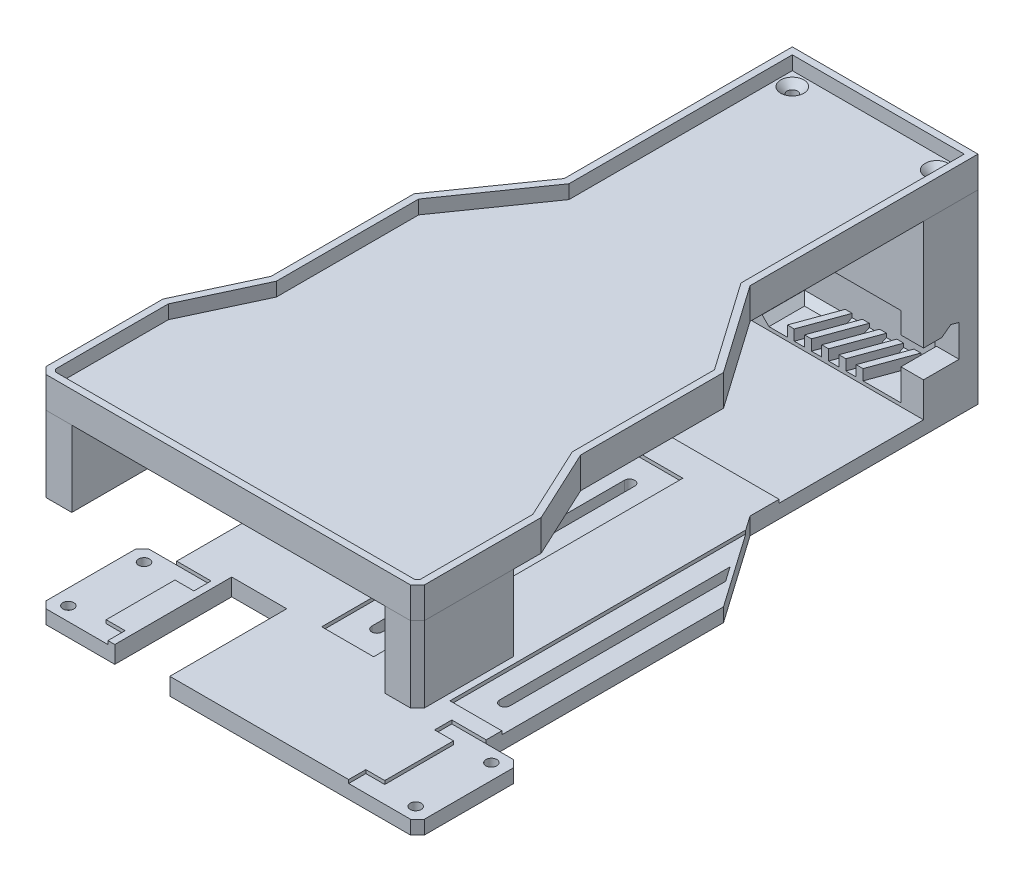
from build123d import *

# Parameters (mm, degrees)
SKETCH1_W                    = 90
SKETCH1_H                    = 190
BOSS_EXTRUDE1_DEPTH          = 5
SKETCH2_W                    = 10
SKETCH2_H                    = 30
BOSS_EXTRUDE2_DEPTH          = 5
CHAMFER1_SIZE                = 2
SKETCH3_W                    = 16
SKETCH3_H                    = 34
CUT_EXTRUDE1_DEPTH           = 50
SKETCH4_W                    = 90
SKETCH4_H                    = 42
CUT_EXTRUDE2_DEPTH           = 1
SKETCH7_W                    = 15.1
SKETCH7_H                    = 89.916335477
CUT_EXTRUDE7_DEPTH           = 1
BOSS_EXTRUDE4_START          = 5
BOSS_EXTRUDE4_DEPTH          = 13
BOSS_EXTRUDE5_DEPTH          = 3.1
CUT_EXTRUDE11_START          = 5
CUT_EXTRUDE11_DEPTH          = 1
CUT_EXTRUDE12_DEPTH          = 112.23848255
CUT_EXTRUDE12_DEPTH_BACK     = 112.23848255
BOSS_EXTRUDE6_DEPTH          = 1
CHAMFER4_SIZE                = 2
CUT_EXTRUDE13_REACH          = 114.094
SKETCH23_R                   = 1.5
CUT_EXTRUDE14_DEPTH          = 113.093556715
CUT_EXTRUDE14_DEPTH_BACK     = 113.093556715
SKETCH27_W                   = 2.002698481
SKETCH27_H                   = 10.340179912
BOSS_EXTRUDE7_DEPTH          = 8
BOSS_EXTRUDE10_DEPTH         = 8
BOSS_EXTRUDE11_OUTLINE_W     = 4.559976017
BOSS_EXTRUDE11_OUTLINE_H     = 15.84
BOSS_EXTRUDE11_DEPTH         = 13
BOSS_EXTRUDE12_DEPTH         = 12
SKETCH34_W                   = 46.940023983
SKETCH34_H                   = 1.75
BOSS_EXTRUDE13_DEPTH         = 12.34
SKETCH35_W                   = 6.562674498
SKETCH35_H                   = 5.170089956
BOSS_EXTRUDE14_DEPTH         = 15.25
SKETCH36_W                   = 6.562674498
SKETCH36_H                   = 8
CUT_EXTRUDE15_DEPTH          = 5.170089956
CHAMFER5_SIZE                = 8.360382376
CHAMFER5_SIZE_2              = 6.3
CHAMFER6_SIZE                = 3
CHAMFER6_SIZE2               = 2.492460212
SKETCH37_W                   = 6.562674498
SKETCH37_H                   = 5.170089956
BOSS_EXTRUDE15_DEPTH         = 1.075733433
BOSS_EXTRUDE16_START         = 24
BOSS_EXTRUDE16_DEPTH         = 5
BOSS_EXTRUDE17_DEPTH         = 4
SKETCH40_W                   = 54
SKETCH40_H                   = 15.84
BOSS_EXTRUDE18_DEPTH         = 24
BOSS_EXTRUDE19_START         = 32
BOSS_EXTRUDE19_DEPTH         = 22
SPLIT1_START                 = 54
SPLIT1_DEPTH                 = 5
SPLIT1_START_2               = 32
SPLIT1_2_DEPTH               = 22
SPLIT1_START_3               = 59
SPLIT1_3_DEPTH               = 4
SPLIT1_4_DEPTH               = 9
SPLIT1_5_DEPTH               = 22
BOSS_EXTRUDE20_DEPTH         = 4
CSK_FOR_M3_SFHCS1_AT_2_COUNT = 2
CSK_FOR_M3_SFHCS1_AT_2_PITCH = 22
CSK_FOR_M3_SFHCS1_AT_3_COUNT = 2
CSK_FOR_M3_SFHCS1_AT_3_PITCH = 103.368273663
CSK_FOR_M3_SFHCS1_AT_4_COUNT = 2
CSK_FOR_M3_SFHCS1_AT_4_PITCH = 101
CSK_FOR_M3_SFHCS2_AT_2_COUNT = 2
CSK_FOR_M3_SFHCS2_AT_2_PITCH = 42
SPLIT2_START                 = 32
SPLIT2_DEPTH                 = 22
SPLIT2_2_DEPTH               = 22
SPLIT2_3_DEPTH               = 22


# Read off the part's stored shape, not the designer's step: Boss-Extrude11, Split1, Split2
with BuildPart() as part:
    # Sketch1 → Boss-Extrude1 (new body)
    with BuildSketch(Plane(origin=(0, 0, 0), x_dir=(1, 0, 0), z_dir=(0, 1, 0))):
        Rectangle(SKETCH1_W, SKETCH1_H)
    extrude(amount=BOSS_EXTRUDE1_DEPTH)

    # Sketch2 → Boss-Extrude2 (add)
    with BuildSketch(Plane(origin=(0, 0, 0), x_dir=(1, 0, 0), z_dir=(0, 1, 0))):
        with Locations((-50, -80)):
            Rectangle(SKETCH2_W, SKETCH2_H)
        with Locations((50, -80)):
            Rectangle(SKETCH2_W, SKETCH2_H)
    extrude(amount=BOSS_EXTRUDE2_DEPTH)

    # Chamfer1
    chamfer1_edges = [part.edges().sort_by_distance(p)[0] for p in [
        (-55, 2.5, 65),
        (-55, 2.5, 95),
        (55, 2.5, 95),
        (55, 2.5, 65),
    ]]
    chamfer(chamfer1_edges, length=CHAMFER1_SIZE)

    # Sketch3 → Cut-Extrude1 (cut)
    with BuildSketch(Plane(origin=(0, 5, 0), x_dir=(1, 0, 0), z_dir=(0, 1, 0))):
        with Locations((-25, -78)):
            Rectangle(SKETCH3_W, SKETCH3_H)
    extrude(amount=-CUT_EXTRUDE1_DEPTH, mode=Mode.SUBTRACT)

    # Sketch4 → Cut-Extrude2 (cut)
    with BuildSketch(Plane(origin=(0, 5, 0), x_dir=(1, 0, 0), z_dir=(0, 1, 0))):
        with Locations((0, 59.159820088)):
            Rectangle(SKETCH4_W, SKETCH4_H)
    extrude(amount=-CUT_EXTRUDE2_DEPTH, mode=Mode.SUBTRACT)

    # Sketch7 → Cut-Extrude7 (cut)
    with BuildSketch(Plane(origin=(0, 5, 0), x_dir=(1, 0, 0), z_dir=(0, 1, 0))):
        with Locations((37.45, -15.495273531)):
            Rectangle(SKETCH7_W, SKETCH7_H)
        with Locations((0.16773297, -15.495273531)):
            Rectangle(SKETCH7_W, SKETCH7_H)
    extrude(amount=-CUT_EXTRUDE7_DEPTH, mode=Mode.SUBTRACT)

    # Sketch17 → Boss-Extrude4 (add)
    with BuildSketch(Plane(origin=(0, 0, 0), x_dir=(1, 0, 0), z_dir=(0, 1, 0)).offset(BOSS_EXTRUDE4_START)):
        Polygon((-22.440023983, 80.159820088), (-19.940023983, 80.159820088), (-19.940023983, 92.499820088), (18.940023983, 92.499820088), (19.940023983, 91.499820088), (19.940023983, 90.5), (22.440023983, 90.5), (22.440023983, 92.535353994), (19.975557889, 94.999820088), (-22.440023983, 94.999820088), align=None)
    extrude(amount=BOSS_EXTRUDE4_DEPTH)

    # Sketch18 → Boss-Extrude5 (add)
    with BuildSketch(Plane(origin=(0, 5, 0), x_dir=(1, 0, 0), z_dir=(0, 1, 0))):
        Polygon((-12.599634528, 80.159820088), (-10.599634528, 80.159820088), (-6.108241837, 92.499820088), (-8.108241837, 92.499820088), align=None)
        Polygon((-3.108241837, 92.499820088), (-7.599634528, 80.159820088), (-5.599634528, 80.159820088), (-1.108241837, 92.499820088), align=None)
        Polygon((1.891758163, 92.499820088), (-2.599634528, 80.159820088), (-0.599634528, 80.159820088), (3.891758163, 92.499820088), align=None)
        Polygon((6.891758163, 92.499820088), (2.400365472, 80.159820088), (4.400365472, 80.159820088), (8.891758163, 92.499820088), align=None)
        Polygon((11.891758163, 92.499820088), (7.400365472, 80.159820088), (9.400365472, 80.159820088), (13.891758163, 92.499820088), align=None)
    extrude(amount=BOSS_EXTRUDE5_DEPTH)

    # Sketch19 → Cut-Extrude11 (cut)
    with BuildSketch(Plane(origin=(0, 0, 0), x_dir=(1, 0, 0), z_dir=(0, 1, 0)).offset(CUT_EXTRUDE11_START)):
        Polygon((-35, -65), (-35, -70), (-40.5, -70), (-40.5, -90), (-35, -90), (-35, -95), (-53, -95), (-55, -93), (-55, -67), (-53, -65), align=None)
    cut_extrude11 = extrude(amount=-CUT_EXTRUDE11_DEPTH, mode=Mode.SUBTRACT)

    # Mirror1: Cut-Extrude11 across plane
    add(cut_extrude11.mirror(Plane(origin=(0, 0, 0), x_dir=(0, 0, 1), z_dir=(1, 0, 0))), mode=Mode.SUBTRACT)

    # Sketch20 → Cut-Extrude12 (cut, two sides: drawn at the far end of the back side and taken through both)
    with BuildSketch(Plane(origin=(0, 0, 0), x_dir=(1, 0, 0), z_dir=(0, 1, 0)).offset(-CUT_EXTRUDE12_DEPTH_BACK)):
        Polygon((-27, 29.706664121), (-45, 4), (-45, 95), (-27, 95), align=None)
        Polygon((27, 95), (27, 29.706664121), (45, 4), (45, 95), align=None)
    extrude(amount=CUT_EXTRUDE12_DEPTH + CUT_EXTRUDE12_DEPTH_BACK, mode=Mode.SUBTRACT)

    # Sketch22 → Boss-Extrude6 (add)
    with BuildSketch(Plane(origin=(0, 0, -94.999820088), x_dir=(-1, 0, 0), z_dir=(0, 0, -1))):
        Polygon((-19.975557889, 5), (-27, 5), (-27, 0), (27, 0), (27, 5), (22.440023983, 5), (22.440023983, 18), (-19.975557889, 18), align=None)
    extrude(amount=BOSS_EXTRUDE6_DEPTH)

    # Chamfer4
    chamfer4_edges = [part.edges().sort_by_distance(p)[0] for p in [
        (-19.940023983, 5, -86.329820088),
        (-14.02413291, 5, -92.499820088),
        (-4.608241837, 5, -92.499820088),
        (0.391758163, 5, -92.499820088),
        (5.391758163, 5, -92.499820088),
        (10.391758163, 5, -92.499820088),
    ]]
    chamfer(chamfer4_edges, length=CHAMFER4_SIZE)

    # Sketch23 → Cut-Extrude13 (cut, up to next)
    with BuildSketch(Plane.XZ, mode=Mode.PRIVATE) as cut_extrude13_sk1:
        with Locations(Location((-50.5, 91, 0), (0, 0, 270))):
            Circle(SKETCH23_R)
    cut_extrude13_tool1 = extrude(cut_extrude13_sk1.sketch, amount=-CUT_EXTRUDE13_REACH, mode=Mode.PRIVATE) & part.part
    # Sketch23 → Cut-Extrude13 (cut, up to next)
    with BuildSketch(Plane.XZ, mode=Mode.PRIVATE) as cut_extrude13_sk2:
        with Locations(Location((-50.5, 69, 0), (0, 0, 270))):
            Circle(SKETCH23_R)
    cut_extrude13_tool2 = extrude(cut_extrude13_sk2.sketch, amount=-CUT_EXTRUDE13_REACH, mode=Mode.PRIVATE) & part.part
    # Sketch23 → Cut-Extrude13 (cut, up to next)
    with BuildSketch(Plane.XZ, mode=Mode.PRIVATE) as cut_extrude13_sk3:
        with Locations(Location((50.5, 69, 0), (0, 0, 270))):
            Circle(SKETCH23_R)
    cut_extrude13_tool3 = extrude(cut_extrude13_sk3.sketch, amount=-CUT_EXTRUDE13_REACH, mode=Mode.PRIVATE) & part.part
    # Sketch23 → Cut-Extrude13 (cut, up to next)
    with BuildSketch(Plane.XZ, mode=Mode.PRIVATE) as cut_extrude13_sk4:
        with Locations(Location((50.5, 91, 0), (0, 0, 270))):
            Circle(SKETCH23_R)
    cut_extrude13_tool4 = extrude(cut_extrude13_sk4.sketch, amount=-CUT_EXTRUDE13_REACH, mode=Mode.PRIVATE) & part.part
    add(cut_extrude13_tool1.solids().sort_by_distance((-50.5, 0, 91))[0], mode=Mode.SUBTRACT)
    add(cut_extrude13_tool2.solids().sort_by_distance((-50.5, 0, 69))[0], mode=Mode.SUBTRACT)
    add(cut_extrude13_tool3.solids().sort_by_distance((50.5, 0, 69))[0], mode=Mode.SUBTRACT)
    add(cut_extrude13_tool4.solids().sort_by_distance((50.5, 0, 91))[0], mode=Mode.SUBTRACT)

    # Sketch25 → Cut-Extrude14 (cut, two sides: drawn at the far end of the back side and taken through both)
    with BuildSketch(Plane.XZ.offset(-CUT_EXTRUDE14_DEPTH_BACK)):
        with BuildLine():
            Line((1.71773297, 51.988728589), (1.71773297, -21.462894208))
            ThreePointArc((1.71773297, -21.462894208), (0.21773297, -22.962894208), (-1.28226703, -21.462894208))
            Line((-1.28226703, -21.462894208), (-1.28226703, 51.988728589))
            ThreePointArc((-1.28226703, 51.988728589), (0.21773297, 53.488728589), (1.71773297, 51.988728589))
        make_face()
        with BuildLine():
            Line((38.9, 51.988728589), (38.9, -21.462894208))
            ThreePointArc((38.9, -21.462894208), (37.4, -22.962894208), (35.9, -21.462894208))
            Line((35.9, -21.462894208), (35.9, 51.988728589))
            ThreePointArc((35.9, 51.988728589), (37.4, 53.488728589), (38.9, 51.988728589))
        make_face()
    extrude(amount=CUT_EXTRUDE14_DEPTH + CUT_EXTRUDE14_DEPTH_BACK, mode=Mode.SUBTRACT)

    # Sketch27 → Boss-Extrude7 (add)
    with BuildSketch(Plane(origin=(0, 5, 0), x_dir=(1, 0, 0), z_dir=(0, 1, 0))):
        with Locations((21.438674742, 85.329910044)):
            Rectangle(SKETCH27_W, SKETCH27_H)
    extrude(amount=BOSS_EXTRUDE7_DEPTH)

    # Sketch31 → Boss-Extrude10 (add)
    with BuildSketch(Plane(origin=(0, 5, 0), x_dir=(1, 0, 0), z_dir=(0, 1, 0))):
        Polygon((22.440023983, 92.535353994), (22.440023983, 80.159820088), (27, 80.159820088), (27, 95.999820088), (19.975557889, 95.999820088), (19.975557889, 94.999820088), align=None)
    extrude(amount=BOSS_EXTRUDE10_DEPTH)

    # Boss-Extrude11 outline → Boss-Extrude11 (add)
    with BuildSketch(Plane(origin=(0, 5, 0), x_dir=(1, 0, 0), z_dir=(0, 1, 0))):
        Polygon((22.440023983, 90.5), (27, 90.5), (27, 95.999820088), (19.975557889, 95.999820088), (19.975557889, 94.999820088), (22.440023983, 92.535353994), align=None)
        with Locations((-24.720011992, 88.079820088)):
            Rectangle(BOSS_EXTRUDE11_OUTLINE_W, BOSS_EXTRUDE11_OUTLINE_H)
    extrude(amount=BOSS_EXTRUDE11_DEPTH)

    # Sketch33 → Boss-Extrude12 (add)
    with BuildSketch(Plane(origin=(0, 18, 0), x_dir=(1, 0, 0), z_dir=(0, 1, 0))):
        Polygon((19.940023983, 90.5), (27, 90.5), (27, 95.999820088), (-27, 95.999820088), (-27, 80.159820088), (-19.940023983, 80.159820088), (-19.940023983, 92.499820088), (18.940023983, 92.499820088), (19.940023983, 91.499820088), align=None)
    extrude(amount=BOSS_EXTRUDE12_DEPTH)

    # Sketch34 → Boss-Extrude13 (add)
    with BuildSketch(Plane.XY.offset(-92.499820088)):
        with Locations((3.529988009, 29.125)):
            Rectangle(SKETCH34_W, SKETCH34_H)
    extrude(amount=BOSS_EXTRUDE13_DEPTH)

    # Sketch35 → Boss-Extrude14 (add)
    with BuildSketch(Plane(origin=(0, 13, 0), x_dir=(1, 0, 0), z_dir=(0, 1, 0))):
        with Locations((23.718662751, 82.744865066)):
            Rectangle(SKETCH35_W, SKETCH35_H)
    extrude(amount=BOSS_EXTRUDE14_DEPTH)

    # Sketch36 → Cut-Extrude15 (cut)
    with BuildSketch(Plane.XY.offset(-80.159820088)):
        with Locations((23.718662751, 18.075733433)):
            Rectangle(SKETCH36_W, SKETCH36_H)
    extrude(amount=-CUT_EXTRUDE15_DEPTH, mode=Mode.SUBTRACT)

    # Chamfer5
    # the kernel refuses this chamfer: 8.360382376, 6.3 mm, written as the material it adds along each edge
    with BuildSketch(Plane(origin=(27, 28.25, -85.329910044), x_dir=(0, 0.023321052992756976, -0.9997280272590685), z_dir=(-1, 0, 0))) as chamfer5_piece_1_section:
        Polygon((CHAMFER5_SIZE * 0.999728027284, CHAMFER5_SIZE * 0.0233210529933), (-CHAMFER5_SIZE_2 * 0.0233210529928, CHAMFER5_SIZE_2 * 0.999728027259), (0, 0), align=None)
    chamfer5_piece_1 = extrude(amount=6.562674498, mode=Mode.PRIVATE)
    chamfer5_piece_1 = split(chamfer5_piece_1, bisect_by=Plane(origin=(25.118661311, 22.075733433, -88.202521449), z_dir=(0, 1, 0)), keep=Keep.TOP, mode=Mode.PRIVATE)
    add(chamfer5_piece_1)

    # Chamfer6
    chamfer6_edges = [part.edges().sort_by_distance(p)[0] for p in [
        (23.718662751, 25.845942226, -90.5),
    ]]
    chamfer6_side = [part.faces().sort_by_distance(p)[0] for p in [
        (23.718662751, 23.960837829, -87.998381973),
    ]]
    chamfer(chamfer6_edges, length=CHAMFER6_SIZE, length2=CHAMFER6_SIZE2, reference=chamfer6_side[0])

    # Sketch37 → Boss-Extrude15 (add)
    with BuildSketch(Plane(origin=(0, 13, 0), x_dir=(1, 0, 0), z_dir=(0, 1, 0))):
        with Locations((23.718662751, 87.914955022)):
            Rectangle(SKETCH37_W, SKETCH37_H)
    extrude(amount=BOSS_EXTRUDE15_DEPTH)



with BuildPart() as body_2:
    # Sketch38 → Boss-Extrude16 (new body)
    with BuildSketch(Plane(origin=(0, 30, 0), x_dir=(1, 0, 0), z_dir=(0, 1, 0)).offset(BOSS_EXTRUDE16_START)):
        Polygon((-55, -59), (-55, -93), (-53, -95), (53, -95), (55, -93), (55, -59), (45, -37.554930795), (45, 4), (27, 29.706664121), (27, 95.999820088), (-27, 95.999820088), (-27, 29.706664121), (-45, 4), (-45, -37.554930795), align=None)
    extrude(amount=BOSS_EXTRUDE16_DEPTH)

    # Sketch39 → Boss-Extrude17 (add)
    with BuildSketch(Plane(origin=(0, 59, 0), x_dir=(1, 0, 0), z_dir=(0, 1, 0))):
        Polygon((55, -59), (45, -37.554930795), (45, 4), (27, 29.706664121), (27, 95.999820088), (-27, 95.999820088), (-27, 29.706664121), (-45, 4), (-45, -37.554930795), (-55, -59), (-55, -93), (-53, -95), (53, -95), (55, -93), align=None)
        Polygon((-43, -37.99832012), (-53, -59.443389325), (-53, -92.171572875), (-52.171572875, -93), (52.171572875, -93), (53, -92.171572875), (53, -59.443389325), (43, -37.99832012), (43, 3.369402422), (25, 29.076066544), (25, 93.999820088), (-25, 93.999820088), (-25, 29.076066544), (-43, 3.369402422), align=None, mode=Mode.SUBTRACT)
    extrude(amount=BOSS_EXTRUDE17_DEPTH)


with BuildPart() as part_1:
    add(part.part)

    add(body_2.part)  # Boss-Extrude18 merges body 2
    # Sketch40 → Boss-Extrude18 (add)
    with BuildSketch(Plane(origin=(0, 30, 0), x_dir=(1, 0, 0), z_dir=(0, 1, 0))):
        with Locations((0, 88.079820088)):
            Rectangle(SKETCH40_W, SKETCH40_H)
    extrude(amount=BOSS_EXTRUDE18_DEPTH)

    # Sketch41 → Boss-Extrude19 (add)
    with BuildSketch(Plane(origin=(0, 0, 0), x_dir=(1, 0, 0), z_dir=(0, 1, 0)).offset(BOSS_EXTRUDE19_START)):
        Polygon((-45.5, -65), (-53, -65), (-55, -67), (-55, -93), (-53, -95), (-45.5, -95), align=None)
        Polygon((45.5, -95), (53, -95), (55, -93), (55, -67), (53, -65), (45.5, -65), align=None)
    extrude(amount=BOSS_EXTRUDE19_DEPTH)

    # Split1 4 outline → Split1 4 (cut)
    with BuildSketch(Plane(origin=(0, 0, 0), x_dir=(1, 0, 0), z_dir=(0, 1, 0)).offset(SPLIT1_START)):
        Polygon((27, 29.706664121), (27, 95.999820088), (-27, 95.999820088), (-27, 29.706664121), (-45, 4), (-45, -37.554930795), (-55, -59), (-55, -93), (-53, -95), (53, -95), (55, -93), (55, -59), (45, -37.554930795), (45, 4), align=None)
    extrude(amount=SPLIT1_4_DEPTH, mode=Mode.SUBTRACT)

    # Split1 5 outline → Split1 5 (cut)
    with BuildSketch(Plane(origin=(0, 0, 0), x_dir=(1, 0, 0), z_dir=(0, 1, 0)).offset(SPLIT1_START_2)):
        Polygon((55, -93), (55, -67), (53, -65), (45.5, -65), (45.5, -95), (53, -95), align=None)
        Polygon((-53, -65), (-55, -67), (-55, -93), (-53, -95), (-45.5, -95), (-45.5, -65), align=None)
    extrude(amount=SPLIT1_5_DEPTH, mode=Mode.SUBTRACT)

    # Sketch43 → Boss-Extrude20 (add)
    with BuildSketch(Plane.XZ):
        Polygon((35.9, -14.996146861), (38.9, -10.711702841), (38.9, -12.711702841), (35.9, -16.996146861), align=None)
    extrude(amount=-BOSS_EXTRUDE20_DEPTH)

    # Sketch45 → CSK for M3 SFHCS1 (revolve, cut)
    with BuildSketch(Plane(origin=(50.5, 0, 91), x_dir=(0, 0, -1), z_dir=(1, 0, 0))):
        Polygon((0, 0), (0, 32), (1.6, 31.03862301), (1.6, 1.76), (3.36, 0), align=None)
    csk_for_m3_sfhcs1 = revolve(axis=Axis((50.5, -6.35, 91), (0, 1, 0)), mode=Mode.SUBTRACT)

    # CSK for M3 SFHCS1 at 2: CSK for M3 SFHCS1 ×2
    with Locations(*[(0, 0, -i * CSK_FOR_M3_SFHCS1_AT_2_PITCH) for i in range(1, CSK_FOR_M3_SFHCS1_AT_2_COUNT)]):
        add(csk_for_m3_sfhcs1, mode=Mode.SUBTRACT)

    # CSK for M3 SFHCS1 at 3: CSK for M3 SFHCS1 ×2
    with Locations(*[Vector(-0.9770889695769172, 0, -0.21283126069992253) * (i * CSK_FOR_M3_SFHCS1_AT_3_PITCH) for i in range(1, CSK_FOR_M3_SFHCS1_AT_3_COUNT)]):
        add(csk_for_m3_sfhcs1, mode=Mode.SUBTRACT)

    # CSK for M3 SFHCS1 at 4: CSK for M3 SFHCS1 ×2
    with Locations(*[(-i * CSK_FOR_M3_SFHCS1_AT_4_PITCH, 0, 0) for i in range(1, CSK_FOR_M3_SFHCS1_AT_4_COUNT)]):
        add(csk_for_m3_sfhcs1, mode=Mode.SUBTRACT)


with BuildPart() as body_2_2:
    # Split1 outline → Split1 (new body)
    with BuildSketch(Plane(origin=(0, 0, 0), x_dir=(1, 0, 0), z_dir=(0, 1, 0)).offset(SPLIT1_START)):
        Polygon((-53, -95), (53, -95), (55, -93), (55, -59), (45, -37.554930795), (45, 4), (27, 29.706664121), (27, 95.999820088), (-27, 95.999820088), (-27, 29.706664121), (-45, 4), (-45, -37.554930795), (-55, -59), (-55, -93), align=None)
    extrude(amount=SPLIT1_DEPTH)

    # Split1 2 outline → Split1 2 (add)
    with BuildSketch(Plane(origin=(0, 0, 0), x_dir=(1, 0, 0), z_dir=(0, 1, 0)).offset(SPLIT1_START_2)):
        Polygon((-45.5, -95), (-45.5, -65), (-53, -65), (-55, -67), (-55, -93), (-53, -95), align=None)
        Polygon((45.5, -65), (45.5, -95), (53, -95), (55, -93), (55, -67), (53, -65), align=None)
    extrude(amount=SPLIT1_2_DEPTH)

    # Split1 3 outline → Split1 3 (add)
    with BuildSketch(Plane(origin=(0, 0, 0), x_dir=(1, 0, 0), z_dir=(0, 1, 0)).offset(SPLIT1_START_3)):
        Polygon((-53, -95), (53, -95), (55, -93), (55, -59), (45, -37.554930795), (45, 4), (27, 29.706664121), (27, 95.999820088), (-27, 95.999820088), (-27, 29.706664121), (-45, 4), (-45, -37.554930795), (-55, -59), (-55, -93), align=None)
        Polygon((-52.171572875, -93), (-53, -92.171572875), (-53, -59.443389325), (-43, -37.99832012), (-43, 3.369402422), (-25, 29.076066544), (-25, 93.999820088), (25, 93.999820088), (25, 29.076066544), (43, 3.369402422), (43, -37.99832012), (53, -59.443389325), (53, -92.171572875), (52.171572875, -93), align=None, mode=Mode.SUBTRACT)
    extrude(amount=SPLIT1_3_DEPTH)


with BuildPart() as csk_for_m3_sfhcs2_tool:
    # Sketch50 → CSK for M3 SFHCS2 (revolve)
    with BuildSketch(Plane(origin=(-21, 59, -89.999820088), x_dir=(0, 0, 1), z_dir=(1, 0, 0))):
        Polygon((0, 0), (0, 16), (1.5, 15.098709071), (1.5, 1.86), (3.36, 0), align=None)
    csk_for_m3_sfhcs2 = revolve(axis=Axis((-21, 65.35, -89.999820088), (0, -1, 0)))


with BuildPart() as part_2:
    add(part_1.part)

    # CSK for M3 SFHCS2: cut by csk_for_m3_sfhcs2_tool
    add(csk_for_m3_sfhcs2_tool.part, mode=Mode.SUBTRACT)


with BuildPart() as body_2_2_1:
    add(body_2_2.part)

    # CSK for M3 SFHCS2: cut by csk_for_m3_sfhcs2_tool
    add(csk_for_m3_sfhcs2_tool.part, mode=Mode.SUBTRACT)


with BuildPart() as csk_for_m3_sfhcs2_at_2_tool:
    # CSK for M3 SFHCS2 at 2: CSK for M3 SFHCS2 ×2
    with Locations(*[(i * CSK_FOR_M3_SFHCS2_AT_2_PITCH, 0, 0) for i in range(1, CSK_FOR_M3_SFHCS2_AT_2_COUNT)]):
        add(csk_for_m3_sfhcs2)


with BuildPart() as part_3:
    add(part_2.part)

    # CSK for M3 SFHCS2 at 2: cut by csk_for_m3_sfhcs2_at_2_tool
    add(csk_for_m3_sfhcs2_at_2_tool.part, mode=Mode.SUBTRACT)


with BuildPart() as body_2_2_2:
    add(body_2_2_1.part)

    # CSK for M3 SFHCS2 at 2: cut by csk_for_m3_sfhcs2_at_2_tool
    add(csk_for_m3_sfhcs2_at_2_tool.part, mode=Mode.SUBTRACT)

    # Split2 outline → Split2 (cut)
    with BuildSketch(Plane(origin=(0, 0, 0), x_dir=(1, 0, 0), z_dir=(0, 1, 0)).offset(SPLIT2_START)):
        Polygon((-53, -95), (-45.5, -95), (-45.5, -65), (-53, -65), (-55, -67), (-55, -93), align=None)
        Polygon((53, -65), (45.5, -65), (45.5, -95), (53, -95), (55, -93), (55, -67), align=None)
    extrude(amount=SPLIT2_DEPTH, mode=Mode.SUBTRACT)


with BuildPart() as body_3:
    # Split2 2 outline → Split2 2 (new body)
    with BuildSketch(Plane(origin=(0, 0, 0), x_dir=(1, 0, 0), z_dir=(0, 1, 0)).offset(SPLIT2_START)):
        Polygon((45.5, -95), (53, -95), (55, -93), (55, -67), (53, -65), (45.5, -65), align=None)
    extrude(amount=SPLIT2_2_DEPTH)


with BuildPart() as body_4:
    # Split2 3 outline → Split2 3 (new body)
    with BuildSketch(Plane(origin=(0, 0, 0), x_dir=(1, 0, 0), z_dir=(0, 1, 0)).offset(SPLIT2_START)):
        Polygon((-53, -65), (-55, -67), (-55, -93), (-53, -95), (-45.5, -95), (-45.5, -65), align=None)
    extrude(amount=SPLIT2_3_DEPTH)


solid = Compound([part_3.part, body_2_2_2.part, body_3.part, body_4.part])
